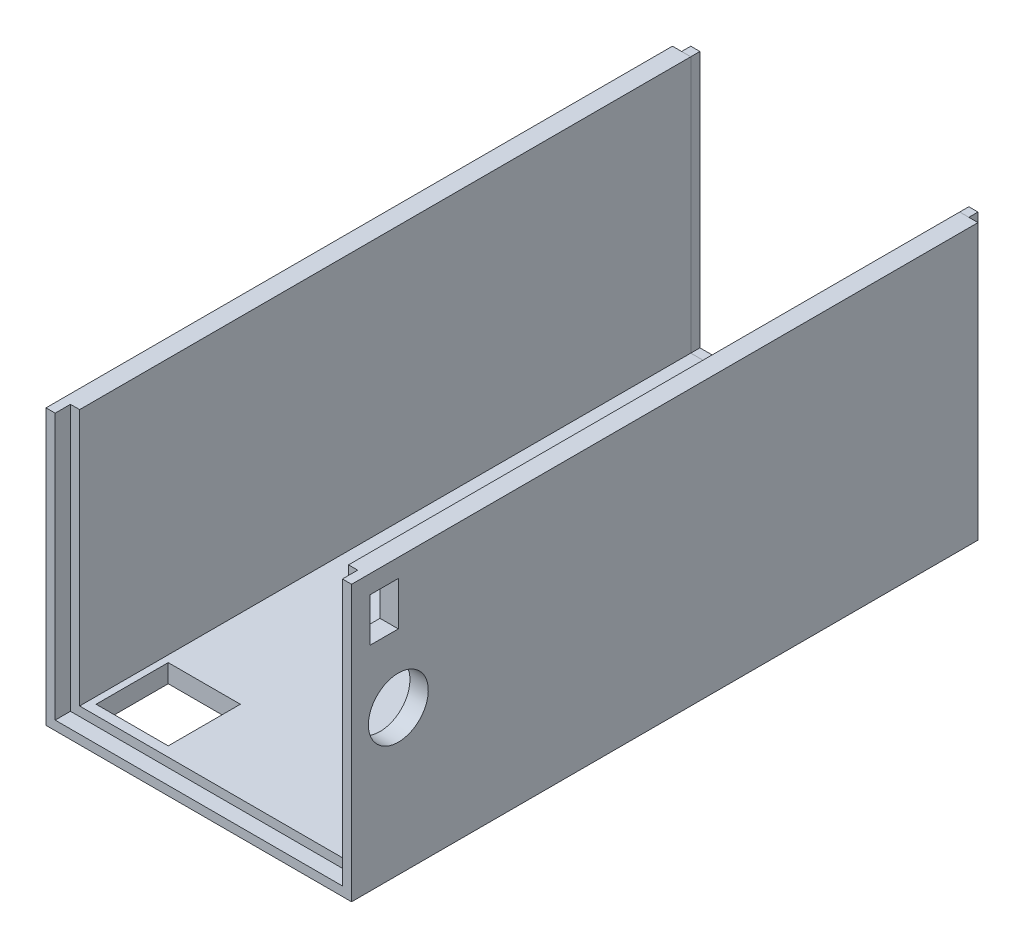
from build123d import *

# Parameters (mm, degrees)
SALIENTE_EXTRUIR1_DEPTH = 3
SALIENTE_EXTRUIR2_DEPTH = 100
SIMETR_A2_START         = -3
SIMETR_A2_OUTLINE_W     = 6
SIMETR_A2_OUTLINE_H     = 100
SIMETR_A2_DEPTH         = 90
SIMETR_A2_2_OUTLINE_W   = 88
SIMETR_A2_2_OUTLINE_H   = 100
SIMETR_A2_2_DEPTH       = 6
CROQUIS3_W              = 12.5
CROQUIS3_H              = 23
CORTAR_EXTRUIR1_DEPTH   = 6
CROQUIS5_W              = 23.6
CROQUIS5_H              = 23.6
CORTAR_EXTRUIR3_DEPTH   = 10
SALIENTE_EXTRUIR3_DEPTH = 5
CROQUIS7_R              = 9.8
CROQUIS7_W              = 9.3
CROQUIS7_H              = 14.3
CORTAR_EXTRUIR4_DEPTH   = 10


# Read off the part's stored shape, not the designer's step: Simetría2
with BuildPart() as part:
    # Croquis1 → Saliente-Extruir1 (new body)
    with BuildSketch(Plane.XY):
        Polygon((-47, 0), (47, 0), (47, 87), (44, 87), (44, 3), (-44, 3), (-44, 87), (-47, 87), align=None)
    extrude(amount=SALIENTE_EXTRUIR1_DEPTH)


with BuildPart() as body_2:
    # Croquis2 → Saliente-Extruir2 (new body)
    with BuildSketch(Plane.XY.offset(3)):
        Polygon((-44, 87), (-44, 3), (44, 3), (44, 87), (50, 87), (50, -3), (-50, -3), (-50, 87), align=None)
    extrude(amount=SALIENTE_EXTRUIR2_DEPTH)

    # Simetría2 outline → Simetría2 (add)
    with BuildSketch(Plane(origin=(0, 0, 0), x_dir=(1, 0, 0), z_dir=(0, 1, 0)).offset(SIMETR_A2_START)):
        with Locations((-47, -153)):
            Rectangle(SIMETR_A2_OUTLINE_W, SIMETR_A2_OUTLINE_H)
        with Locations((47, -153)):
            Rectangle(SIMETR_A2_OUTLINE_W, SIMETR_A2_OUTLINE_H)
    extrude(amount=SIMETR_A2_DEPTH)

    # Simetr_a2 2 outline → Simetr_a2 2 (add)
    with BuildSketch(Plane(origin=(0, 0, 0), x_dir=(1, 0, 0), z_dir=(0, 1, 0)).offset(SIMETR_A2_START)):
        with Locations((0, -153)):
            Rectangle(SIMETR_A2_2_OUTLINE_W, SIMETR_A2_2_OUTLINE_H)
    extrude(amount=SIMETR_A2_2_DEPTH)

    # Croquis3 → Cortar-Extruir1 (cut)
    with BuildSketch(Plane(origin=(0, 3, 0), x_dir=(1, 0, 0), z_dir=(0, 1, 0))):
        with Locations((0, -103)):
            Rectangle(CROQUIS3_W, CROQUIS3_H)
    extrude(amount=-CORTAR_EXTRUIR1_DEPTH, mode=Mode.SUBTRACT)

    # Croquis5 → Cortar-Extruir3 (cut)
    with BuildSketch(Plane.XZ.offset(3)):
        with Locations((-30, 188)):
            Rectangle(CROQUIS5_W, CROQUIS5_H)
    extrude(amount=-CORTAR_EXTRUIR3_DEPTH, mode=Mode.SUBTRACT)

    # Croquis6 → Saliente-Extruir3 (add)
    with BuildSketch(Plane.XY.offset(203)):
        Polygon((-50, 87), (-47, 87), (-47, 0), (47, 0), (47, 87), (50, 87), (50, -3), (-50, -3), align=None)
    extrude(amount=SALIENTE_EXTRUIR3_DEPTH)

    # Croquis7 → Cortar-Extruir4 (cut)
    with BuildSketch(Plane(origin=(50, 0, 0), x_dir=(0, 0, -1), z_dir=(1, 0, 0))):
        with Locations(Location((-192.7, 44.4, 0), (0, 0, 90))):
            Circle(CROQUIS7_R)
        with Locations((-197.35, 73.85)):
            Rectangle(CROQUIS7_W, CROQUIS7_H)
    extrude(amount=-CORTAR_EXTRUIR4_DEPTH, mode=Mode.SUBTRACT)


solid = Compound([part.part, body_2.part])
